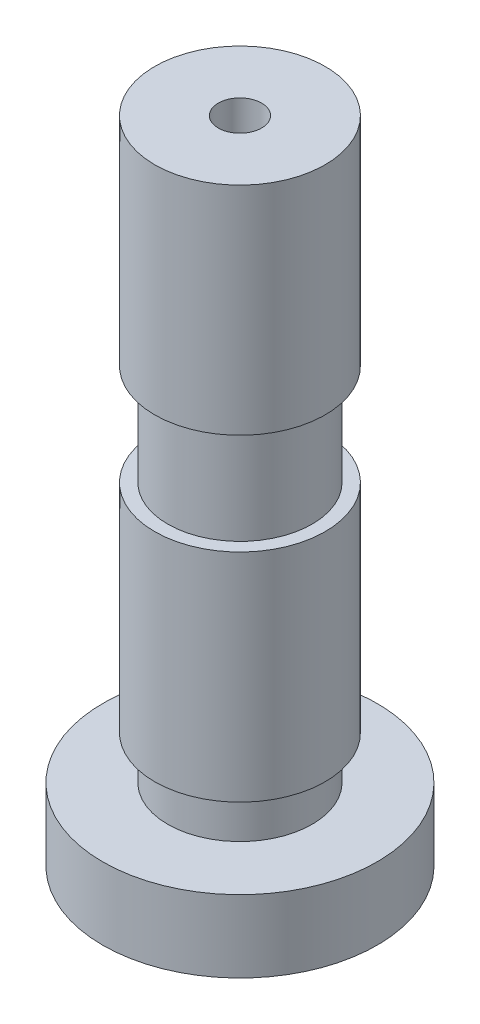
from build123d import *

# Parameters (mm, degrees)
SKETCH_2_R          = 1.5
CUT_EXTRUDE_1_DEPTH = 3
CUT_EXTRUDE_START   = -3
SKETCH_3_R          = 1.5
CUT_EXTRUDE_2_DEPTH = 3


with BuildPart() as part:
    # Эскиз1 → Повернуть1 (revolve)
    with BuildSketch(Plane.XY):
        Polygon((0, 0), (9.5, 0), (9.5, 5), (5, 5), (5, 8), (5.9, 8), (5.9, 23), (5, 23), (5, 30), (5.9, 30), (5.9, 45), (0, 45), align=None)
    revolve(axis=Axis((0, 14.6467512, 0), (0, -1, 0)))

    # Эскиз2 → Вырез-Вытянуть1 (cut)
    with BuildSketch(Plane(origin=(0, 45, 0), x_dir=(1, 0, 0), z_dir=(0, 1, 0))):
        Circle(SKETCH_2_R)
    extrude(amount=-CUT_EXTRUDE_1_DEPTH, mode=Mode.SUBTRACT)

    # Эскиз3 → Вырез-Вытянуть2 (cut)
    with BuildSketch(Plane(origin=(0, 0, 0), x_dir=(-1, 0, 0), z_dir=(0, -1, 0)).offset(CUT_EXTRUDE_START)):
        Circle(SKETCH_3_R)
    extrude(amount=CUT_EXTRUDE_2_DEPTH, mode=Mode.SUBTRACT)


solid = part.part
